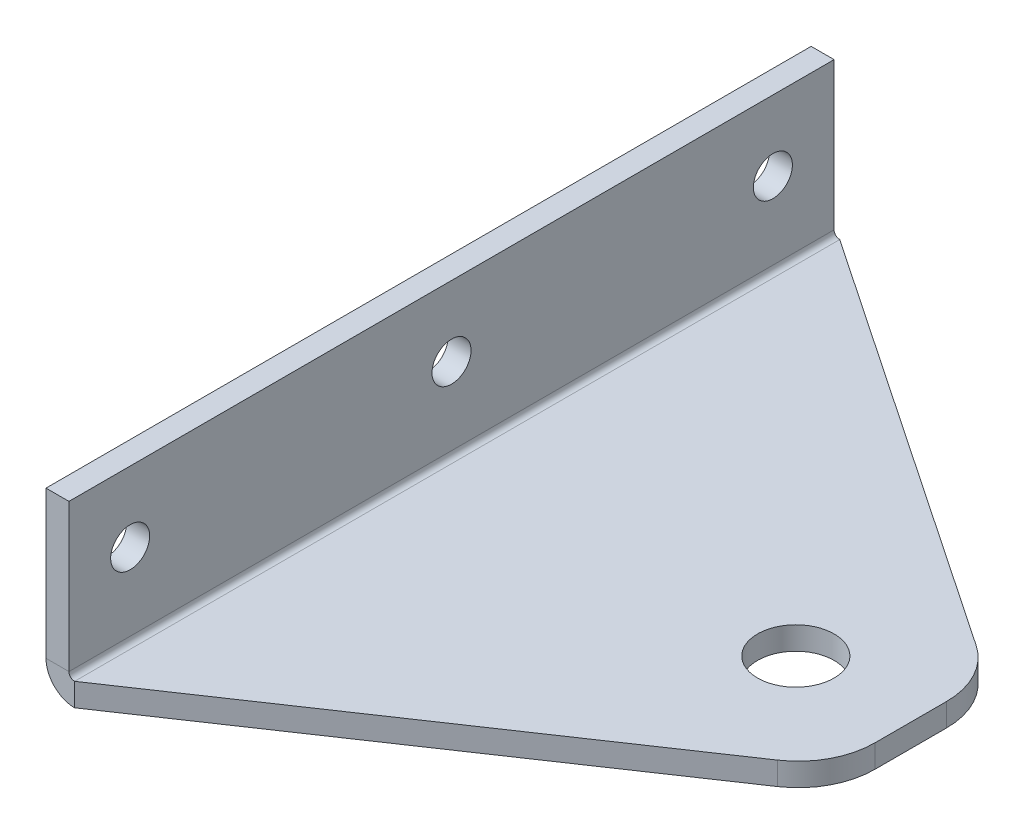
from build123d import *

# Parameters (mm, degrees)
BASE_FLANGE1_DEPTH = 100
CUT_EXTRUDE1_REACH = 120.322
SKETCH6_R          = 2.55
CUT_EXTRUDE2_REACH = 120.322
SKETCH7_R          = 5
CUT_EXTRUDE4_DEPTH = 10


# Sheet-metal steps are written as plain solids
with BuildPart() as part:
    # Sketch1 → Base-Flange1 (new body)
    with BuildSketch(Plane.XY):
        with BuildLine():
            Line((0, 20), (0, 0.7366))
            ThreePointArc((0, 0.7366), (0.215745145, 0.215745145), (0.7366, 0))
            Line((0.7366, 0), (60, 0))
            Line((60, 0), (60, -3))
            Line((60, -3), (0.7366, -3))
            ThreePointArc((0.7366, -3), (-1.905575199, -1.905575199), (-3, 0.7366))
            Line((-3, 0.7366), (-3, 20))
            Line((-3, 20), (0, 20))
        make_face()
    extrude(amount=BASE_FLANGE1_DEPTH)

    # Sketch6 → Cut-Extrude1 (cut, up to next)
    with BuildSketch(Plane(origin=(0, 0, 0), x_dir=(0, 0, -1), z_dir=(1, 0, 0)), mode=Mode.PRIVATE) as cut_extrude1_sk1:
        with Locations(Location((-92, 10.813082186, 0), (0, 0, 90))):
            Circle(SKETCH6_R)
    cut_extrude1_tool1 = extrude(cut_extrude1_sk1.sketch, amount=-CUT_EXTRUDE1_REACH, mode=Mode.PRIVATE) & part.part
    # Sketch6 → Cut-Extrude1 (cut, up to next)
    with BuildSketch(Plane(origin=(0, 0, 0), x_dir=(0, 0, -1), z_dir=(1, 0, 0)), mode=Mode.PRIVATE) as cut_extrude1_sk2:
        with Locations(Location((-8, 10.813082186, 0), (0, 0, 90))):
            Circle(SKETCH6_R)
    cut_extrude1_tool2 = extrude(cut_extrude1_sk2.sketch, amount=-CUT_EXTRUDE1_REACH, mode=Mode.PRIVATE) & part.part
    # Sketch6 → Cut-Extrude1 (cut, up to next)
    with BuildSketch(Plane(origin=(0, 0, 0), x_dir=(0, 0, -1), z_dir=(1, 0, 0)), mode=Mode.PRIVATE) as cut_extrude1_sk3:
        with Locations(Location((-50, 10.813082186, 0), (0, 0, 90))):
            Circle(SKETCH6_R)
    cut_extrude1_tool3 = extrude(cut_extrude1_sk3.sketch, amount=-CUT_EXTRUDE1_REACH, mode=Mode.PRIVATE) & part.part
    add(cut_extrude1_tool1.solids().sort_by_distance((0, 10.813082, 92))[0], mode=Mode.SUBTRACT)
    add(cut_extrude1_tool2.solids().sort_by_distance((0, 10.813082, 8))[0], mode=Mode.SUBTRACT)
    add(cut_extrude1_tool3.solids().sort_by_distance((0, 10.813082, 50))[0], mode=Mode.SUBTRACT)

    # Sketch7 → Cut-Extrude2 (cut, up to next)
    with BuildSketch(Plane(origin=(0, 0, 0), x_dir=(1, 0, 0), z_dir=(0, 1, 0)), mode=Mode.PRIVATE) as cut_extrude2_sk1:
        with Locations(Location((45, -50, 0), (0, 0, 270))):
            Circle(SKETCH7_R)
    cut_extrude2_tool1 = extrude(cut_extrude2_sk1.sketch, amount=-CUT_EXTRUDE2_REACH, mode=Mode.PRIVATE) & part.part
    add(cut_extrude2_tool1.solids().sort_by_distance((45, 0, 50))[0], mode=Mode.SUBTRACT)

    # Sketch8 → Cut-Extrude4 (cut)
    with BuildSketch(Plane(origin=(0, 0, 0), x_dir=(1, 0, 0), z_dir=(0, 1, 0))):
        with BuildLine():
            Line((0.7366, 0), (55.594459994, -37.026468271))
            ThreePointArc((55.594459994, -37.026468271), (58.830192522, -40.621768617), (60, -45.315136281))
            Line((60, -45.315136281), (60, -54.684863719))
            ThreePointArc((60, -54.684863719), (58.830192522, -59.378231383), (55.594459994, -62.973531729))
            Line((55.594459994, -62.973531729), (0.7366, -100))
            Line((0.7366, -100), (64.682636993, -100))
            Line((64.682636993, -100), (64.682636993, 0))
            Line((64.682636993, 0), (0.7366, 0))
        make_face()
    extrude(amount=-CUT_EXTRUDE4_DEPTH, mode=Mode.SUBTRACT)


solid = part.part
